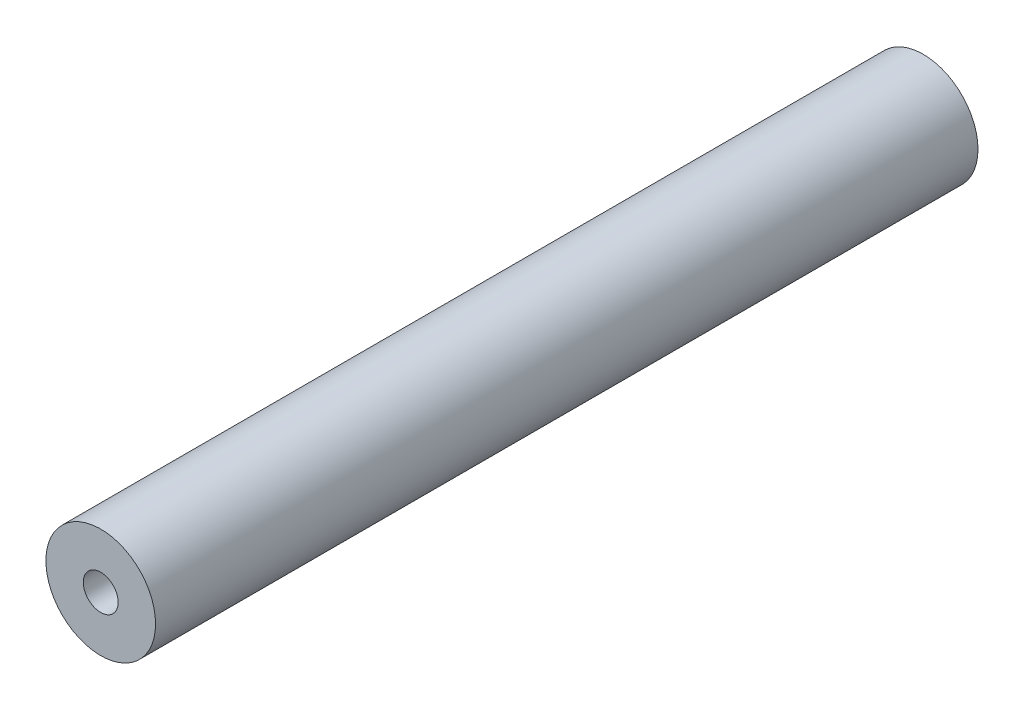
from build123d import *

# Parameters (mm, degrees)
SKETCH1_R                            = 6.35
BOSS_EXTRUDE1_DEPTH                  = 47.625
F_10_32_TAPPED_HOLE1_D               = 4.0386
F_10_32_TAPPED_HOLE1_DEPTH           = 12.02944
F_10_32_TAPPED_HOLE1_TIP             = 1.213317848
F_10_32_TAPPED_HOLE1_ON_FACE_2_D     = 4.0386
F_10_32_TAPPED_HOLE1_ON_FACE_2_DEPTH = 12.02944
F_10_32_TAPPED_HOLE1_ON_FACE_2_TIP   = 1.213317848


with BuildPart() as part:
    # Sketch1 → Boss-Extrude1 (new, symmetric)
    with BuildSketch(Plane.XY):
        Circle(SKETCH1_R)
    extrude(amount=BOSS_EXTRUDE1_DEPTH, both=True)

    # #10-32 Tapped Hole1
    with Locations(Plane.XY.offset(47.625)):
        with Locations((0, 0)):
            Hole(F_10_32_TAPPED_HOLE1_D / 2, depth=F_10_32_TAPPED_HOLE1_DEPTH)
            with Locations((0, 0, -(F_10_32_TAPPED_HOLE1_DEPTH + F_10_32_TAPPED_HOLE1_TIP / 2))):  # 118° drill point
                Cone(0, F_10_32_TAPPED_HOLE1_D / 2, F_10_32_TAPPED_HOLE1_TIP, mode=Mode.SUBTRACT)

    # #10-32 Tapped Hole1 on face 2
    with Locations(Plane(origin=(0, 0, -47.625), x_dir=(-1, 0, 0), z_dir=(0, 0, -1))):
        with Locations((0, 0)):
            Hole(F_10_32_TAPPED_HOLE1_ON_FACE_2_D / 2, depth=F_10_32_TAPPED_HOLE1_ON_FACE_2_DEPTH)
            with Locations((0, 0, -(F_10_32_TAPPED_HOLE1_ON_FACE_2_DEPTH + F_10_32_TAPPED_HOLE1_ON_FACE_2_TIP / 2))):  # 118° drill point
                Cone(0, F_10_32_TAPPED_HOLE1_ON_FACE_2_D / 2, F_10_32_TAPPED_HOLE1_ON_FACE_2_TIP, mode=Mode.SUBTRACT)


solid = part.part
